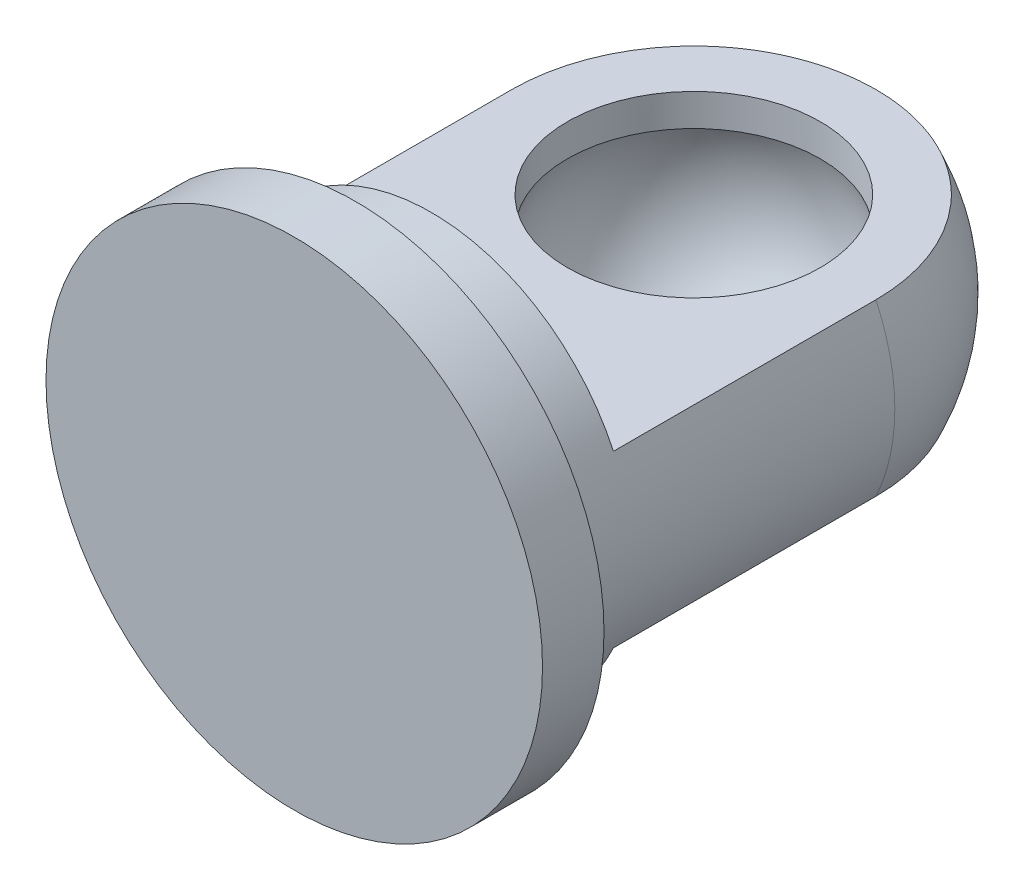
from build123d import *

# Parameters (mm, degrees)
CUT_EXTRUDE_START    = -2.9
SKETCH_2_OUTSIDE_W   = 16.408
SKETCH_2_OUTSIDE_H   = 16.408
SKETCH_2_OUTSIDE_W_2 = 15
SKETCH_2_OUTSIDE_H_2 = 3.6
CUT_EXTRUDE_1_DEPTH  = 10
CUT_EXTRUDE_2_REACH  = 17.445
SKETCH_3_R           = 2.675


with BuildPart() as part:
    # Эскиз1 → Повернуть1 (revolve)
    with BuildSketch(Plane(origin=(0, 0, 0), x_dir=(1, 0, 0), z_dir=(0, 1, 0))):
        with BuildLine():
            Line((0, 0), (5.25, 0))
            Line((5.25, 0), (5.25, 1.3))
            Line((5.25, 1.3), (4.25, 1.3))
            Line((4.25, 1.3), (4.25, 8.45))
            ThreePointArc((4.25, 8.45), (3.00520382, 11.45520382), (0, 12.7))
            Line((0, 12.7), (0, 11.35))
            ThreePointArc((0, 11.35), (2.9, 8.45), (0, 5.55))
            Line((0, 5.55), (0, 0))
        make_face()
    revolve(axis=Axis((0, 0, -1.3), (0, 0, -1)))

    # Эскиз2 outside → Вырез-Вытянуть1 (cut)
    with BuildSketch(Plane.XY.offset(CUT_EXTRUDE_START)):
        Rectangle(SKETCH_2_OUTSIDE_W, SKETCH_2_OUTSIDE_H)
        Rectangle(SKETCH_2_OUTSIDE_W_2, SKETCH_2_OUTSIDE_H_2, mode=Mode.SUBTRACT)
    extrude(amount=-CUT_EXTRUDE_1_DEPTH, mode=Mode.SUBTRACT)

    # Эскиз3 → Вырез-Вытянуть2 (cut, up to next)
    with BuildSketch(Plane(origin=(0, 1.8, 0), x_dir=(1, 0, 0), z_dir=(0, 1, 0)), mode=Mode.PRIVATE) as cut_extrude_2_sk1:
        with Locations((0, 8.45)):
            Circle(SKETCH_3_R)
    cut_extrude_2_tool1 = extrude(cut_extrude_2_sk1.sketch, amount=-CUT_EXTRUDE_2_REACH, mode=Mode.PRIVATE) & part.part
    add(cut_extrude_2_tool1.solids().sort_by_distance((0, 1.8, -8.45))[0], mode=Mode.SUBTRACT)


solid = part.part
